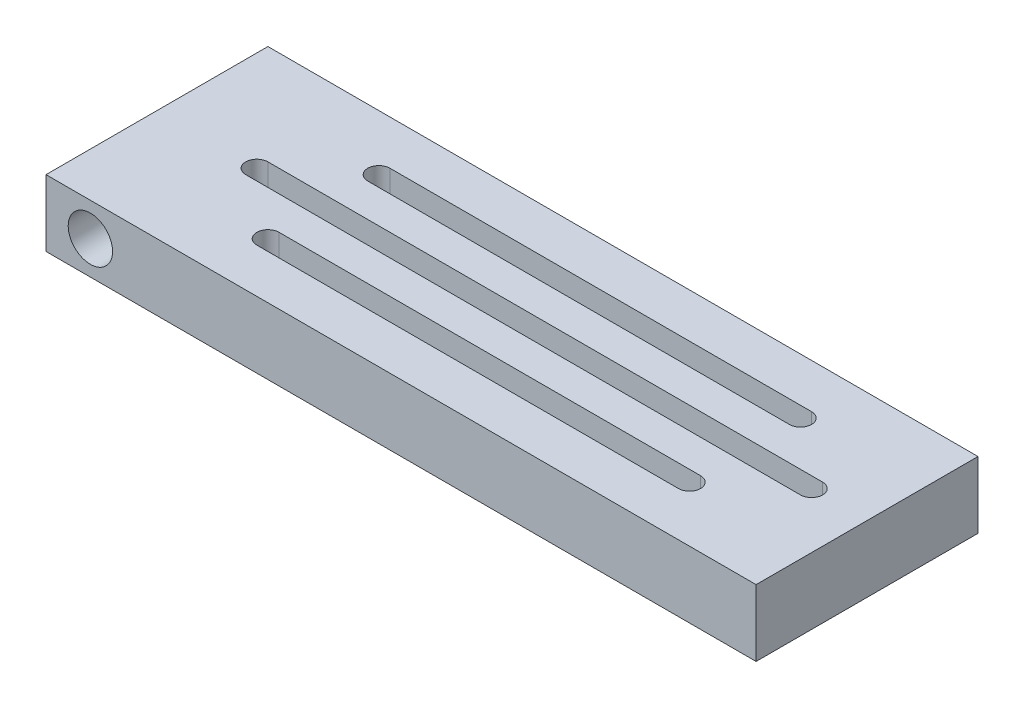
from build123d import *

# Parameters (mm, degrees)
SKETCH1_W           = 203.2
SKETCH1_H           = 63.5
BOSS_EXTRUDE1_DEPTH = 9.525
CUT_EXTRUDE1_DEPTH  = 109.136603424
CUT_EXTRUDE2_REACH  = 122.19
SKETCH3_R           = 6.35


with BuildPart() as part:
    # Sketch1 → Boss-Extrude1 (new, symmetric)
    with BuildSketch(Plane(origin=(0, 0, 0), x_dir=(1, 0, 0), z_dir=(0, 1, 0))):
        Rectangle(SKETCH1_W, SKETCH1_H)
    extrude(amount=BOSS_EXTRUDE1_DEPTH, both=True)

    # Sketch2 → Cut-Extrude1 (cut, through all)
    with BuildSketch(Plane(origin=(0, 9.525, 0), x_dir=(1, 0, 0), z_dir=(0, 1, 0))):
        with BuildLine():
            Line((-73.025, 3.175), (85.725, 3.175))
            ThreePointArc((85.725, 3.175), (88.9, 0), (85.725, -3.175))
            Line((85.725, -3.175), (-73.025, -3.175))
            ThreePointArc((-73.025, -3.175), (-76.2, 0), (-73.025, 3.175))
        make_face()
        with BuildLine():
            Line((-53.975, 19.05), (66.675, 19.05))
            ThreePointArc((66.675, 19.05), (69.85, 15.875), (66.675, 12.7))
            Line((66.675, 12.7), (-53.975, 12.7))
            ThreePointArc((-53.975, 12.7), (-57.15, 15.875), (-53.975, 19.05))
        make_face()
        with BuildLine():
            Line((-53.975, -12.7), (66.675, -12.7))
            ThreePointArc((66.675, -12.7), (69.85, -15.875), (66.675, -19.05))
            Line((66.675, -19.05), (-53.975, -19.05))
            ThreePointArc((-53.975, -19.05), (-57.15, -15.875), (-53.975, -12.7))
        make_face()
    extrude(amount=-CUT_EXTRUDE1_DEPTH, mode=Mode.SUBTRACT)

    # Sketch3 → Cut-Extrude2 (cut, up to next)
    with BuildSketch(Plane(origin=(0, 0, -31.75), x_dir=(-1, 0, 0), z_dir=(0, 0, -1)), mode=Mode.PRIVATE) as cut_extrude2_sk1:
        with Locations((88.9, 0)):
            Circle(SKETCH3_R)
    cut_extrude2_tool1 = extrude(cut_extrude2_sk1.sketch, amount=-CUT_EXTRUDE2_REACH, mode=Mode.PRIVATE) & part.part
    add(cut_extrude2_tool1.solids().sort_by_distance((-88.9, 0, -31.75))[0], mode=Mode.SUBTRACT)


solid = part.part
